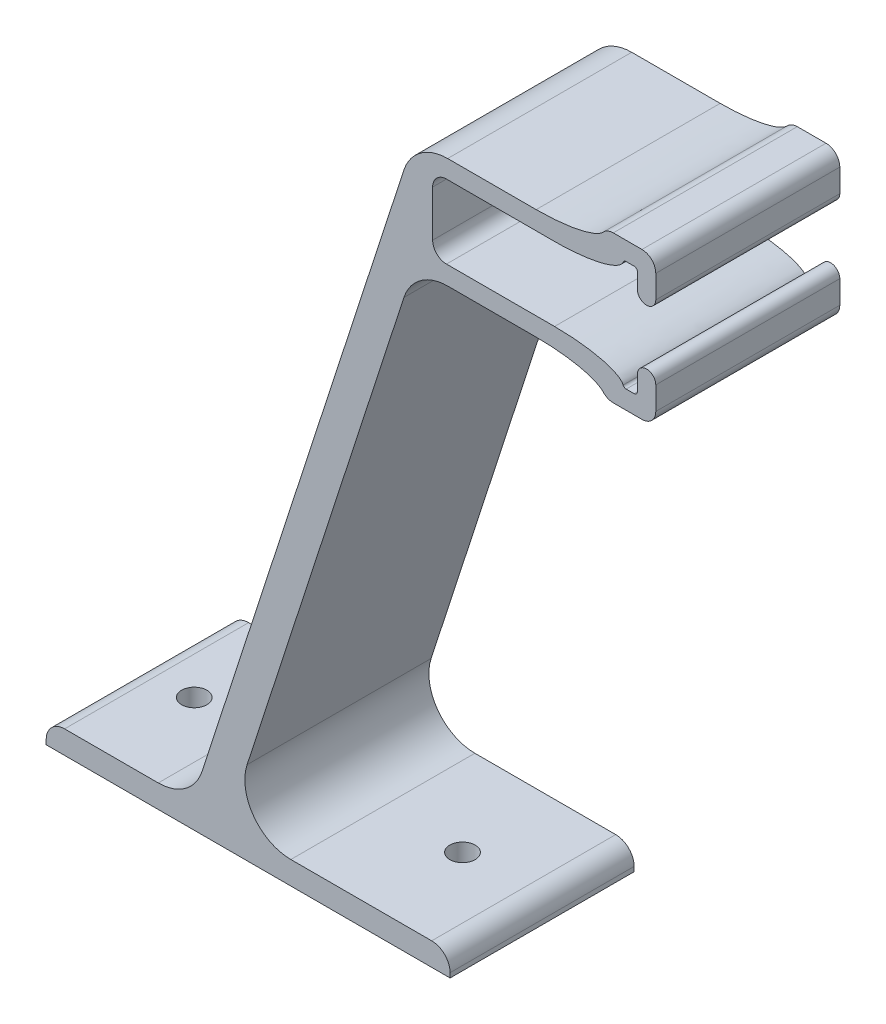
from build123d import *

# Parameters (mm, degrees)
BOSS_EXTRUDE1_DEPTH = 40
FILLET2_SIZE        = 15
FILLET2_SIZE_2      = 4
FILLET3_SIZE        = 15
FILLET3_SIZE_2      = 4
FILLET4_SIZE        = 15
FILLET4_SIZE_2      = 4
FILLET5_SIZE        = 4
FILLET5_SIZE_2      = 15
FILLET6_R           = 3
FILLET7_R           = 3
FILLET8_R           = 0.7
FILLET9_R           = 10
FILLET10_R          = 10
SKETCH2_R           = 2.75
CUT_EXTRUDE1_DEPTH  = 178.22584477
FILLET11_R          = 4


with BuildPart() as part:
    # Sketch1 → Boss-Extrude1 (new body)
    with BuildSketch(Plane.XY):
        with BuildLine():
            Line((41.5, 24), (0, 24))
            Line((0, 24), (-48.376623377, -125))
            Line((-48.376623377, -125), (-80, -125))
            Line((-80, -125), (-80, -130))
            Line((-80, -130), (7.792207792, -130))
            Line((7.792207792, -130), (7.792207792, -125))
            Line((7.792207792, -125), (-40.584415584, -125))
            Line((-40.584415584, -125), (0, 0))
            Line((0, 0), (41.5, 0))
            Line((41.5, 0), (41.5, -4))
            Line((41.5, -4), (52.5, -4))
            Line((52.5, -4), (52.5, 4))
            ThreePointArc((52.5, 4), (50.5, 6), (48.5, 4))
            Line((48.5, 4), (48.5, 0))
            Line((48.5, 0), (45.5, 0))
            Line((45.5, 0), (45.5, 4))
            Line((45.5, 4), (4, 4))
            Line((4, 4), (4, 20))
            Line((4, 20), (45.5, 20))
            Line((45.5, 20), (45.5, 24))
            Line((45.5, 24), (48.5, 24))
            Line((48.5, 24), (48.5, 20))
            ThreePointArc((48.5, 20), (50.5, 18), (52.5, 20))
            Line((52.5, 20), (52.5, 28))
            Line((52.5, 28), (41.5, 28))
            Line((41.5, 28), (41.5, 24))
        make_face()
    extrude(amount=BOSS_EXTRUDE1_DEPTH)

    # Fillet2
    # an asymmetric fillet: 15, 4 mm, written as the material it takes off along each edge
    with BuildSketch(Plane(origin=(45.5, 20, -37.5), x_dir=(-1, 0, 0), z_dir=(0, 0, 1))) as fillet2_piece_1:
        with BuildLine():
            Bezier((FILLET2_SIZE, 0), (0, 0), (0, -FILLET2_SIZE_2), weights=[1, 0.707106781, 1])
            Line((0, -FILLET2_SIZE_2), (0, 0))
            Line((0, 0), (FILLET2_SIZE, 0))
        make_face()
    extrude(amount=115, mode=Mode.SUBTRACT)

    # Fillet3
    # an asymmetric fillet: 15, 4 mm, written as the material it takes off along each edge
    with BuildSketch(Plane(origin=(45.5, 4, -37.5), x_dir=(-1, 0, 0), z_dir=(0, 0, 1))) as fillet3_piece_1:
        with BuildLine():
            Bezier((FILLET3_SIZE, 0), (0, 0), (0, FILLET3_SIZE_2), weights=[1, 0.707106781, 1])
            Line((0, FILLET3_SIZE_2), (0, 0))
            Line((0, 0), (FILLET3_SIZE, 0))
        make_face()
    extrude(amount=115, mode=Mode.SUBTRACT)

    # Fillet4
    # an asymmetric fillet: 15, 4 mm, written as the material it adds along each edge
    with BuildSketch(Plane(origin=(41.5, 24, 0), x_dir=(-1, 0, 0), z_dir=(0, 0, 1))) as fillet4_piece_1:
        with BuildLine():
            Bezier((FILLET4_SIZE, 0), (0, 0), (0, -FILLET4_SIZE_2), weights=[1, 0.707106781, 1])
            Line((0, -FILLET4_SIZE_2), (0, 0))
            Line((0, 0), (FILLET4_SIZE, 0))
        make_face()
    extrude(amount=40)

    # Fillet5
    # an asymmetric fillet: 15, 4 mm, written as the material it adds along each edge
    with BuildSketch(Plane(origin=(41.5, 0, 0), x_dir=(0, -1, 0), z_dir=(0, 0, 1))) as fillet5_piece_1:
        with BuildLine():
            Bezier((FILLET5_SIZE, 0), (0, 0), (0, -FILLET5_SIZE_2), weights=[1, 0.707106781, 1])
            Line((0, -FILLET5_SIZE_2), (0, 0))
            Line((0, 0), (FILLET5_SIZE, 0))
        make_face()
    extrude(amount=40)

    # Fillet6
    fillet6_edges = [part.edges().sort_by_distance(p)[0] for p in [
        (4, 4, 20),
        (4, 20, 20),
    ]]
    fillet(fillet6_edges, radius=FILLET6_R)

    # Fillet7
    fillet7_edges = [part.edges().sort_by_distance(p)[0] for p in [
        (52.5, -4, 20),
        (41.5, -4, 20),
        (41.5, 28, 20),
        (52.5, 28, 20),
    ]]
    fillet(fillet7_edges, radius=FILLET7_R)

    # Fillet8
    fillet8_edges = [part.edges().sort_by_distance(p)[0] for p in [
        (45.5, 0, 20),
        (48.5, 0, 20),
        (48.5, 24, 20),
        (45.5, 24, 20),
    ]]
    fillet(fillet8_edges, radius=FILLET8_R)

    # Fillet9
    fillet9_edges = [part.edges().sort_by_distance(p)[0] for p in [
        (0, 0, 20),
        (0, 24, 20),
    ]]
    fillet(fillet9_edges, radius=FILLET9_R)

    # Fillet10
    fillet10_edges = [part.edges().sort_by_distance(p)[0] for p in [
        (-48.376623377, -125, 20),
        (-40.584415584, -125, 20),
    ]]
    fillet(fillet10_edges, radius=FILLET10_R)

    # Sketch2 → Cut-Extrude1 (cut, through all)
    with BuildSketch(Plane(origin=(0, -125, 0), x_dir=(1, 0, 0), z_dir=(0, 1, 0))):
        with Locations(Location((-67.82186874, -20, 0), (0, 0, 270))):
            Circle(SKETCH2_R)
        with Locations(Location((-9.515793598, -20, 0), (0, 0, 270))):
            Circle(SKETCH2_R)
    extrude(amount=-CUT_EXTRUDE1_DEPTH, mode=Mode.SUBTRACT)

    # Fillet11
    fillet11_edges = [part.edges().sort_by_distance(p)[0] for p in [
        (7.792207792, -125, 20),
        (-80, -125, 20),
    ]]
    fillet(fillet11_edges, radius=FILLET11_R)


solid = part.part
